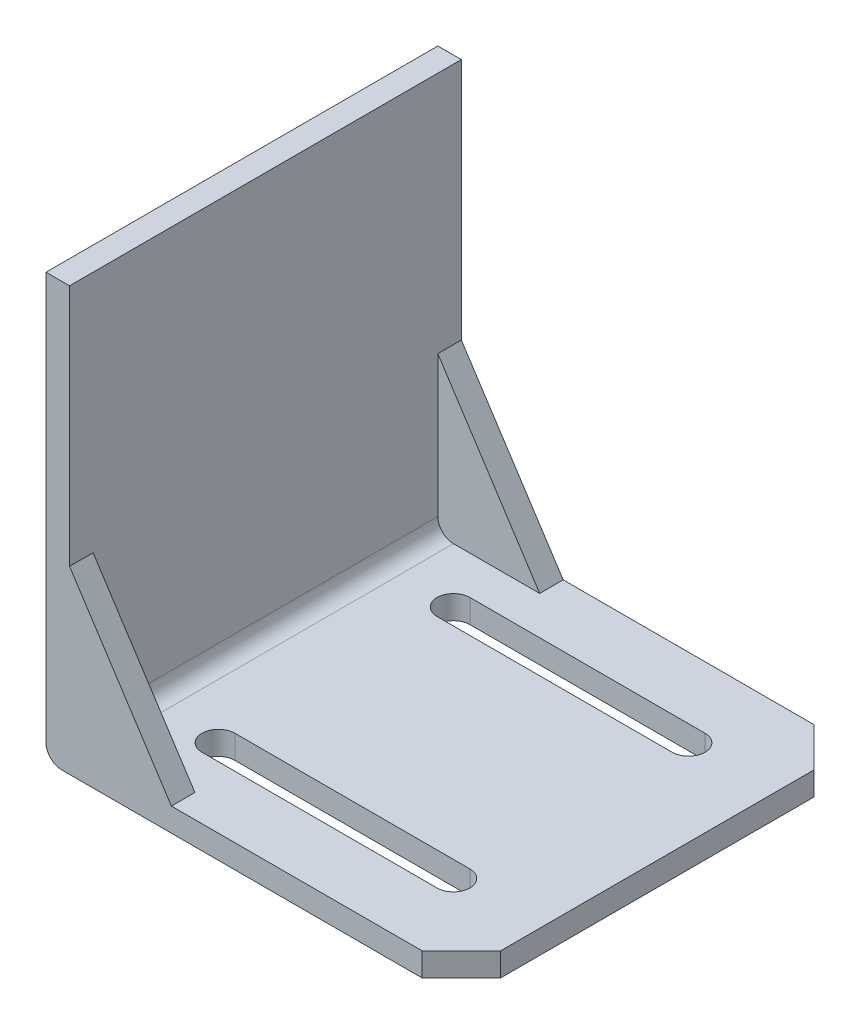
from build123d import *

# Parameters (mm, degrees)
SKETCH_1_W          = 53
SKETCH_1_H          = 50
EXTRUDE_1_DEPTH     = 3
CHAMFER_1_SIZE      = 5
CUT_EXTRUDE_1_REACH = 38.555
SKETCH_3_W          = 3
SKETCH_3_H          = 50
EXTRUDE_2_DEPTH     = 51
FILLET_1_R          = 2
RIB_1_REACH         = 80.219
SKETCH_6_WALL_W     = 182.292207198
SKETCH_6_WALL_H     = 3
RIB_3_REACH         = 80.219
SKETCH_8_WALL_W     = 182.292207198
SKETCH_8_WALL_H     = 3


with BuildPart() as part:
    # 草图1 → 凸台-拉伸1 (new body)
    with BuildSketch(Plane(origin=(0, 0, 0), x_dir=(1, 0, 0), z_dir=(0, 1, 0))):
        Rectangle(SKETCH_1_W, SKETCH_1_H)
    extrude(amount=EXTRUDE_1_DEPTH)

    # 倒角1
    chamfer_1_edges = [part.edges().sort_by_distance(p)[0] for p in [
        (26.5, 1.5, -25),
        (26.5, 1.5, 25),
    ]]
    chamfer(chamfer_1_edges, length=CHAMFER_1_SIZE)

    # 草图2 → 切除-拉伸1 (cut, up to next)
    with BuildSketch(Plane(origin=(0, 3, 0), x_dir=(1, 0, 0), z_dir=(0, 1, 0)), mode=Mode.PRIVATE) as cut_extrude_1_sk1:
        with BuildLine():
            Line((-14.5, 17.1), (15.5, 17.1))
            ThreePointArc((15.5, 17.1), (17.6, 15), (15.5, 12.9))
            Line((15.5, 12.9), (-14.5, 12.9))
            ThreePointArc((-14.5, 12.9), (-16.6, 15), (-14.5, 17.1))
        make_face()
    cut_extrude_1_tool1 = extrude(cut_extrude_1_sk1.sketch, amount=-CUT_EXTRUDE_1_REACH, mode=Mode.PRIVATE) & part.part
    # 草图2 → 切除-拉伸1 (cut, up to next)
    with BuildSketch(Plane(origin=(0, 3, 0), x_dir=(1, 0, 0), z_dir=(0, 1, 0)), mode=Mode.PRIVATE) as cut_extrude_1_sk2:
        with BuildLine():
            Line((-14.5, -12.9), (15.5, -12.9))
            ThreePointArc((15.5, -12.9), (17.6, -15), (15.5, -17.1))
            Line((15.5, -17.1), (-14.5, -17.1))
            ThreePointArc((-14.5, -17.1), (-16.6, -15), (-14.5, -12.9))
        make_face()
    cut_extrude_1_tool2 = extrude(cut_extrude_1_sk2.sketch, amount=-CUT_EXTRUDE_1_REACH, mode=Mode.PRIVATE) & part.part
    add(cut_extrude_1_tool1.solids().sort_by_distance((0.5, 3, -15))[0], mode=Mode.SUBTRACT)
    add(cut_extrude_1_tool2.solids().sort_by_distance((0.5, 3, 15))[0], mode=Mode.SUBTRACT)

    # 草图3 → 凸台-拉伸2 (add)
    with BuildSketch(Plane(origin=(0, 3, 0), x_dir=(1, 0, 0), z_dir=(0, 1, 0))):
        with Locations((-25, 0)):
            Rectangle(SKETCH_3_W, SKETCH_3_H)
    extrude(amount=EXTRUDE_2_DEPTH)

    # 圆角1
    fillet_1_edges = [part.edges().sort_by_distance(p)[0] for p in [
        (-26.5, 0, 0),
        (-23.5, 3, 0),
    ]]
    fillet(fillet_1_edges, radius=FILLET_1_R)

    # 草图6 wall → 筋1 (add, up to next)
    with BuildSketch(Plane(origin=(-17, 13, 25), x_dir=(0.544988350595, -0.838443616301, 0), z_dir=(0.838443616301, 0.544988350595, 0)), mode=Mode.PRIVATE) as rib_1_sk1:
        with Locations((0, 1.5)):
            Rectangle(SKETCH_6_WALL_W, SKETCH_6_WALL_H)
    rib_1_tool1 = extrude(rib_1_sk1.sketch, amount=-RIB_1_REACH, mode=Mode.PRIVATE) - part.part
    add(rib_1_tool1.solids().sort_by_distance((-17, 13, 25))[0])

    # 草图8 wall → 筋3 (add, up to next)
    with BuildSketch(Plane(origin=(-17, 13, -25), x_dir=(-0.544988350595, 0.838443616301, 0), z_dir=(0.838443616301, 0.544988350595, 0)), mode=Mode.PRIVATE) as rib_3_sk1:
        with Locations((0, 1.5)):
            Rectangle(SKETCH_8_WALL_W, SKETCH_8_WALL_H)
    rib_3_tool1 = extrude(rib_3_sk1.sketch, amount=-RIB_3_REACH, mode=Mode.PRIVATE) - part.part
    add(rib_3_tool1.solids().sort_by_distance((-17, 13, -25))[0])


solid = part.part
